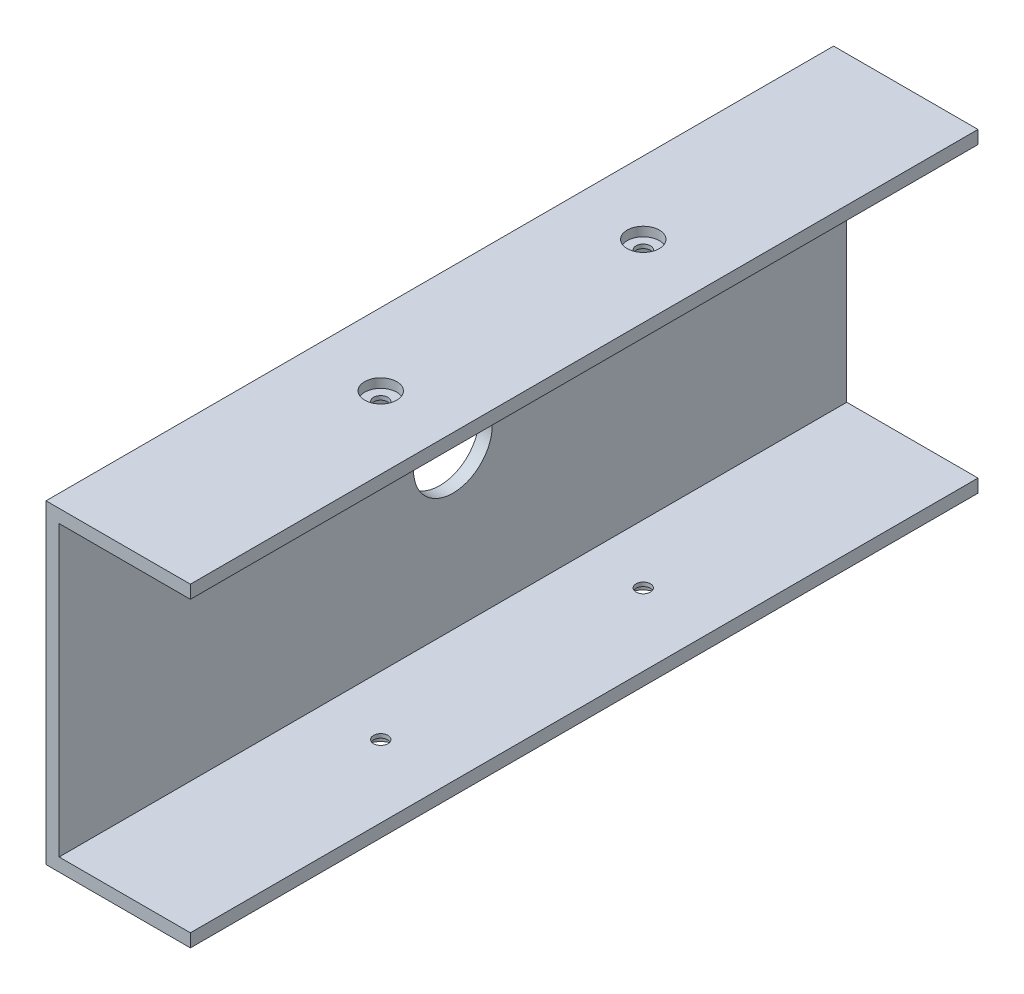
from build123d import *

# Parameters (mm, degrees)
BOSS_EXTRUDE1_DEPTH = 300
LPATTERN2_COUNT     = 2
LPATTERN2_PITCH     = 100
LPATTERN3_COUNT     = 2
LPATTERN3_PITCH     = 100
SKETCH9_R           = 15
CUT_EXTRUDE1_DEPTH  = 313.449732492


with BuildPart() as part:
    # Sketch1 → Boss-Extrude1 (new body)
    with BuildSketch(Plane.XY):
        Polygon((-64.668520253, 67.82208589), (-9.668520253, 67.82208589), (-9.668520253, 62.82208589), (-59.668520253, 62.82208589), (-59.668520253, -47.17791411), (-9.668520253, -47.17791411), (-9.668520253, -52.17791411), (-64.668520253, -52.17791411), align=None)
    extrude(amount=BOSS_EXTRUDE1_DEPTH)

    # Sketch4 → CBORE for M5 Hex Head Bolt1 (revolve, cut)
    with BuildSketch(Plane(origin=(-37.168520253, 67.82208589, 200), x_dir=(0, 0, 1), z_dir=(1, 0, 0))):
        Polygon((0, 0), (0, 11.702366702), (2.75, 10.05), (2.75, 3.5), (6.119, 3.5), (6.119, 0), align=None)
    cbore_for_m5_hex_head_bolt1 = revolve(axis=Axis((-37.168520253, 74.17208589, 200), (0, -1, 0)), mode=Mode.SUBTRACT)

    # LPattern2: CBORE for M5 Hex Head Bolt1 ×2
    with Locations(*[(0, 0, -i * LPATTERN2_PITCH) for i in range(1, LPATTERN2_COUNT)]):
        add(cbore_for_m5_hex_head_bolt1, mode=Mode.SUBTRACT)

    # Sketch8 → CBORE for M5 Hex Head Bolt3 (revolve, cut)
    with BuildSketch(Plane(origin=(-37.168520253, -52.17791411, 200), x_dir=(0, 0, -1), z_dir=(1, 0, 0))):
        Polygon((0, 0), (0, 11.702366702), (2.75, 10.05), (2.75, 3.5), (6.119, 3.5), (6.119, 0), align=None)
    cbore_for_m5_hex_head_bolt3 = revolve(axis=Axis((-37.168520253, -58.52791411, 200), (0, 1, 0)), mode=Mode.SUBTRACT)

    # LPattern3: CBORE for M5 Hex Head Bolt3 ×2
    with Locations(*[(0, 0, -i * LPATTERN3_PITCH) for i in range(1, LPATTERN3_COUNT)]):
        add(cbore_for_m5_hex_head_bolt3, mode=Mode.SUBTRACT)

    # Sketch9 → Cut-Extrude1 (cut, through all)
    with BuildSketch(Plane.ZY.offset(64.668520253)):
        with Locations((150, 12.82208589)):
            Circle(SKETCH9_R)
    extrude(amount=-CUT_EXTRUDE1_DEPTH, mode=Mode.SUBTRACT)


solid = part.part
